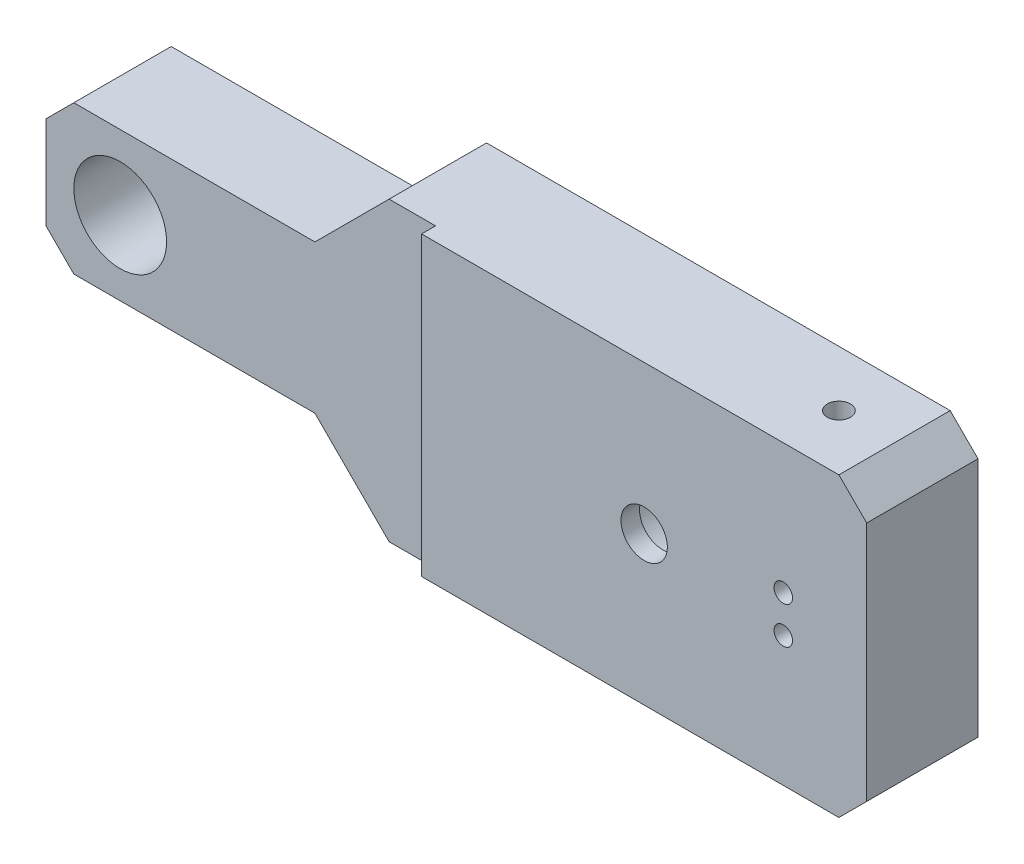
from build123d import *

# Parameters (mm, degrees)
BOSS_EXTRU_1_DEPTH        = 24
TROU_START                = 4
TROU_TARAUD_M61_OUTLINE_R = 2.5
TROU_TARAUD_M61_DEPTH     = 28
ESQUISSE2_W               = 89
ESQUISSE2_H               = 84
ENL_V_MAT_EXTRU_1_DEPTH   = 3
ESQUISSE3_R               = 10
ENL_V_MAT_EXTRU_2_DEPTH   = 185.024454914
ESQUISSE9_R               = 10
ENL_V_MAT_EXTRU_3_DEPTH   = 20
ESQUISSE10_R              = 5
ENL_V_MAT_EXTRU_4_DEPTH   = 184.913022939


# Read off the part's stored shape, not the designer's step: Trou taraudé M61
with BuildPart() as part:
    # Esquisse1 → Boss.-Extru.1 (new body)
    with BuildSketch(Plane.XY):
        Polygon((0, 0), (0, 10), (6, 16), (58, 16), (74, 32), (174, 32), (180, 26), (180, 0), align=None)
    boss_extru_1 = extrude(amount=BOSS_EXTRU_1_DEPTH)

    # Esquisse5 → Dégagement M11 (revolve, cut)
    with BuildSketch(Plane(origin=(162, 4, 24), x_dir=(0, -1, 0), z_dir=(1, 0, 0))):
        Polygon((0, 0), (0, 19.201721238), (2, 18), (2, 0), align=None)
    d_gagement_m11 = revolve(axis=Axis((162, 4, 30.35), (0, 0, -1)), mode=Mode.SUBTRACT)

    # Trou taraudé M61 outline → Trou taraudé M61 (cut)
    with BuildSketch(Plane(origin=(0, 0, 0), x_dir=(1, 0, 0), z_dir=(0, 1, 0)).offset(TROU_START)):
        with Locations((162, -12)):
            Circle(TROU_TARAUD_M61_OUTLINE_R)
    trou_taraud_m61 = extrude(amount=TROU_TARAUD_M61_DEPTH, mode=Mode.SUBTRACT)

    # Symétrie1: Boss.-Extru.1, Dégagement M11, Trou taraudé M61 across Top Plane
    add(boss_extru_1.mirror(Plane(origin=(0, 0, 0), x_dir=(1, 0, 0), z_dir=(0, 1, 0))))
    add(d_gagement_m11.mirror(Plane(origin=(0, 0, 0), x_dir=(1, 0, 0), z_dir=(0, 1, 0))), mode=Mode.SUBTRACT)
    add(trou_taraud_m61.mirror(Plane(origin=(0, 0, 0), x_dir=(1, 0, 0), z_dir=(0, 1, 0))), mode=Mode.SUBTRACT)

    # Esquisse2 → Enlèv. mat.-Extru.1 (cut)
    with BuildSketch(Plane.XY.offset(24)):
        with Locations((39.5, 0)):
            Rectangle(ESQUISSE2_W, ESQUISSE2_H)
    extrude(amount=-ENL_V_MAT_EXTRU_1_DEPTH, mode=Mode.SUBTRACT)

    # Esquisse3 → Enlèv. mat.-Extru.2 (cut, through all)
    with BuildSketch(Plane.XY.offset(21)):
        with Locations((16, 0)):
            Circle(ESQUISSE3_R)
    extrude(amount=-ENL_V_MAT_EXTRU_2_DEPTH, mode=Mode.SUBTRACT)

    # Esquisse9 → Enlèv. mat.-Extru.3 (cut)
    with BuildSketch(Plane(origin=(0, 0, 0), x_dir=(-1, 0, 0), z_dir=(0, 0, -1))):
        with Locations((-132, 0)):
            Circle(ESQUISSE9_R)
    extrude(amount=-ENL_V_MAT_EXTRU_3_DEPTH, mode=Mode.SUBTRACT)

    # Esquisse10 → Enlèv. mat.-Extru.4 (cut, through all)
    with BuildSketch(Plane(origin=(0, 0, 20), x_dir=(-1, 0, 0), z_dir=(0, 0, -1))):
        with Locations((-132, 0)):
            Circle(ESQUISSE10_R)
    extrude(amount=-ENL_V_MAT_EXTRU_4_DEPTH, mode=Mode.SUBTRACT)


solid = part.part
